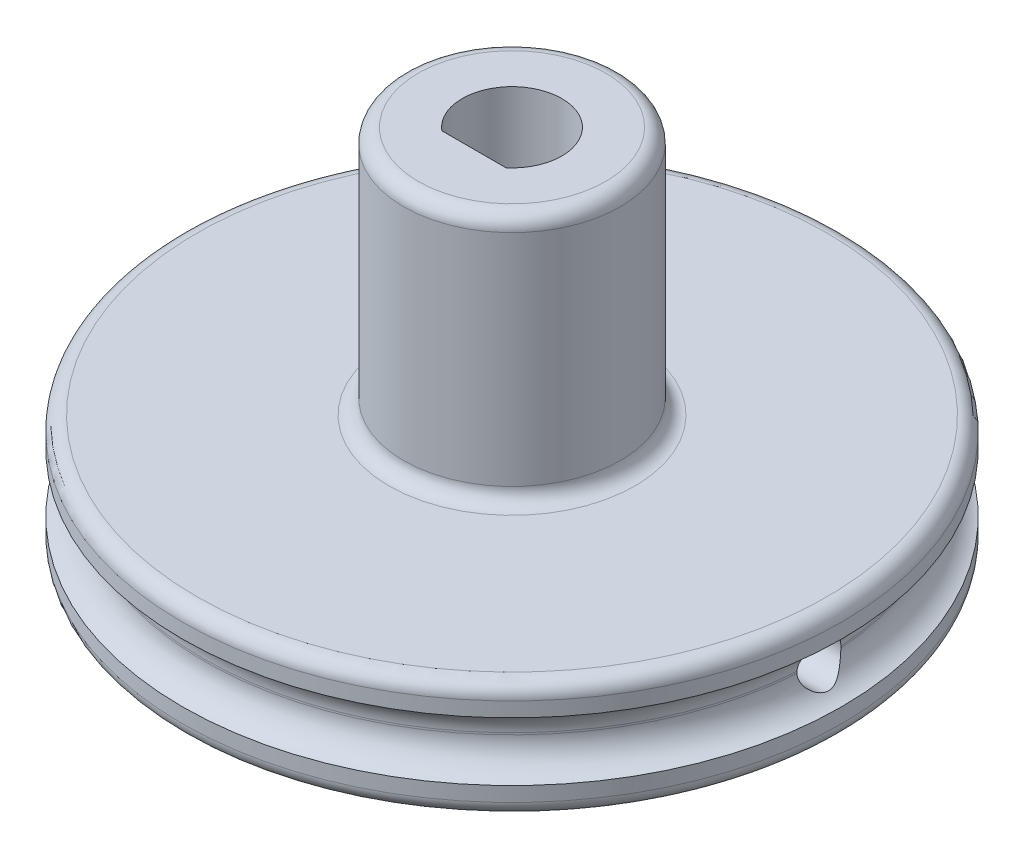
from build123d import *

# Parameters (mm, degrees)
SKETCH1_R            = 11.25
SKETCH1_R_2          = 1.7
BOSS_EXTRUDE1_DEPTH  = 4
SKETCH2_R            = 3.7
BOSS_EXTRUDE2_DEPTH  = 8.5
CUT_SWEEP1_PROFILE_R = 0.75
SKETCH21_R           = 12.5
SKETCH21_R_2         = 10.5
CUT_EXTRUDE1_DEPTH   = 1
FILLET1_R            = 1
FILLET2_R            = 0.5


with BuildPart() as part:
    # Sketch1 → Boss-Extrude1 (new body)
    # profile 1 of 5: a face of its own
    with BuildSketch(Plane(origin=(0, 0, 0), x_dir=(1, 0, 0), z_dir=(0, 1, 0))):
        with Locations(Location((0, 0, 0), (0, 0, 270))):
            Circle(SKETCH1_R)
        Circle(SKETCH1_R_2, mode=Mode.SUBTRACT)
    # profile 2 of 5: a face of its own
    with BuildSketch(Plane(origin=(0, 0, 0), x_dir=(1, 0, 0), z_dir=(0, 1, 0))):
        with BuildLine():
            Line((0, -1.3), (-1.095445115, -1.3))
            ThreePointArc((-1.095445115, -1.3), (-0.583095189, -1.596871942), (0, -1.7))
            Line((0, -1.7), (0, -1.3))
        make_face()
    # profile 3 of 5: a face of its own
    with BuildSketch(Plane(origin=(0, 0, 0), x_dir=(1, 0, 0), z_dir=(0, 1, 0))):
        with BuildLine():
            Line((1.095445115, -1.3), (0, -1.3))
            Line((0, -1.3), (0, -1.7))
            ThreePointArc((0, -1.7), (0.583095189, -1.596871942), (1.095445115, -1.3))
        make_face()
    # profile 4 of 5: a face of its own
    with BuildSketch(Plane(origin=(0, 0, 0), x_dir=(1, 0, 0), z_dir=(0, 1, 0))):
        with BuildLine():
            Line((0, -1.3), (-1.095445115, -1.3))
            ThreePointArc((-1.095445115, -1.3), (-0.583095189, -1.596871942), (0, -1.7))
            Line((0, -1.7), (0, -1.3))
        make_face()
    # profile 5 of 5: a face of its own
    with BuildSketch(Plane(origin=(0, 0, 0), x_dir=(1, 0, 0), z_dir=(0, 1, 0))):
        with BuildLine():
            Line((1.095445115, -1.3), (0, -1.3))
            Line((0, -1.3), (0, -1.7))
            ThreePointArc((0, -1.7), (0.583095189, -1.596871942), (1.095445115, -1.3))
        make_face()
    extrude(amount=BOSS_EXTRUDE1_DEPTH)

    # Sketch2 → Boss-Extrude2 (add)
    with BuildSketch(Plane(origin=(0, 4, 0), x_dir=(1, 0, 0), z_dir=(0, 1, 0))):
        with Locations(Location((0, 0, 0), (0, 0, 270))):
            Circle(SKETCH2_R)
        with BuildLine():
            Line((-1.095445115, -1.3), (1.095445115, -1.3))
            ThreePointArc((1.095445115, -1.3), (0, 1.7), (-1.095445115, -1.3))
        make_face(mode=Mode.SUBTRACT)
    extrude(amount=BOSS_EXTRUDE2_DEPTH)

    # Cut-Sweep1: sweep along a curve in space
    with BuildLine() as cut_sweep1_path:
        Line((12.5, 2, 0), (9.136774381, 2, 0))
        ThreePointArc((7.136774381, 0, 0), (7.722560819, 1.414213562, 0), (9.136774381, 2, 0))
        Line((7.136774381, 0, 0), (7.136774381, -2.281561943, 0))
    # Cut-Sweep1 profile (on start of the path) → Cut-Sweep1 (sweep, cut)
    with BuildSketch(Plane(origin=(12.5, 2, 0), x_dir=(0, -1, 0), z_dir=(-1, 0, 0))):
        Circle(CUT_SWEEP1_PROFILE_R)
    cut_sweep1 = sweep(path=cut_sweep1_path.line, mode=Mode.SUBTRACT)

    # Mirror1: Cut-Sweep1 across plane
    add(cut_sweep1.mirror(Plane(origin=(0, 0, 0), x_dir=(0, 0, 1), z_dir=(1, 0, 0))), mode=Mode.SUBTRACT)

    # Sketch21 → Cut-Extrude1 (cut, symmetric)
    with BuildSketch(Plane(origin=(0, 2, 0), x_dir=(1, 0, 0), z_dir=(0, 1, 0))):
        Circle(SKETCH21_R)
        with Locations(Location((0, 0, 0), (0, 0, 270))):
            Circle(SKETCH21_R_2, mode=Mode.SUBTRACT)
    extrude(amount=CUT_EXTRUDE1_DEPTH, both=True, mode=Mode.SUBTRACT)

    # Fillet1
    # the kernel refuses this fillet: 1 mm, written as the material it adds along each edge
    with BuildSketch(Plane(origin=(0, 1, 0), x_dir=(0, 0, 1), z_dir=(-1, 0, 0))) as fillet1_piece_1_section:
        with BuildLine():
            CenterArc((11.5, 0.968245837), FILLET1_R, 180, 75.522487814)
            Line((10.5, 0.968245837), (10.48, 0.968245837))
            Line((10.48, 0.968245837), (10.48, 0))
            Line((10.48, 0), (10.5, -0.02))
            ThreePointArc((10.5, -0.02), (10.875, -0.02), (11.245, -0.019364917))
            Line((11.245, -0.019364917), (11.25, 0))
        make_face()
    fillet1_piece_1 = revolve(axis=Axis((0, 1, 0), (0, 1, 0)), mode=Mode.PRIVATE)
    fillet1_piece_1 = fillet1_piece_1 - Plane(origin=(0, 2, 0), x_dir=(0, -1, 0), z_dir=(-1, 0, 0)) * Cylinder(0.75, 45, mode=Mode.PRIVATE)
    add(fillet1_piece_1)
    with BuildSketch(Plane(origin=(0, 3, 0), x_dir=(0, 0, 1), z_dir=(-1, 0, 0))) as fillet1_piece_2_section:
        with BuildLine():
            CenterArc((11.5, -0.968245837), FILLET1_R, 104.477512186, 75.522487814)
            Line((11.25, 0), (11.245, 0.019364917))
            ThreePointArc((11.245, 0.019364917), (10.875, 0.02), (10.5, 0.02))
            Line((10.5, 0.02), (10.48, 0))
            Line((10.48, 0), (10.48, -0.968245837))
            Line((10.48, -0.968245837), (10.5, -0.968245837))
        make_face()
    fillet1_piece_2 = revolve(axis=Axis((0, 3, 0), (0, 1, 0)), mode=Mode.PRIVATE)
    fillet1_piece_2 = fillet1_piece_2 - Plane(origin=(0, 2, 0), x_dir=(0, -1, 0), z_dir=(-1, 0, 0)) * Cylinder(0.75, 45, mode=Mode.PRIVATE)
    add(fillet1_piece_2)

    # Fillet2
    fillet2_edges = [part.edges().sort_by_distance(p)[0] for p in [
        (0, 12.5, -3.7),
        (0, 4, -3.7),
        (0, 4, -11.25),
        (0, 0, -11.25),
    ]]
    fillet(fillet2_edges, radius=FILLET2_R)


solid = part.part
